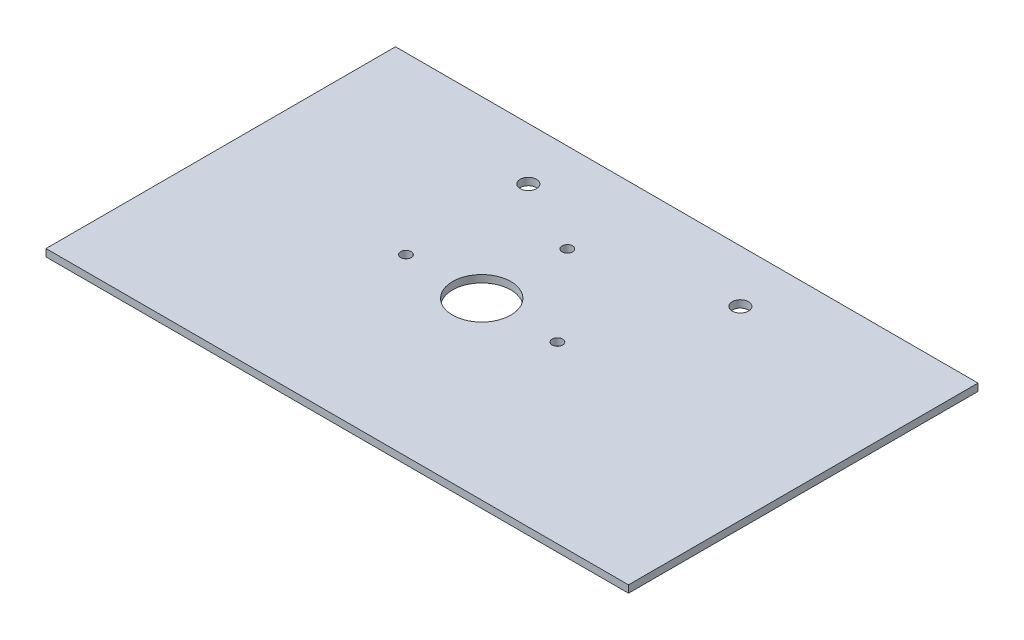
from build123d import *

# Parameters (mm, degrees)
SKETCH1_W          = 254
SKETCH1_H          = 3.175
BASE_FLANGE1_DEPTH = 76.2
SKETCH6_R          = 12.7
CUT_EXTRUDE1_DEPTH = 266.202791511
SKETCH7_R          = 2.286
CUT_EXTRUDE2_DEPTH = 266.202791511
SKETCH8_R          = 2.286
CUT_EXTRUDE3_DEPTH = 266.202791511
SKETCH9_R          = 3.556
CUT_EXTRUDE4_DEPTH = 266.202791511


# Sheet-metal steps are written as plain solids
with BuildPart() as part:
    # Sketch1 → Base-Flange1 (new, symmetric)
    with BuildSketch(Plane.XY):
        with Locations((-127, 1.5875)):
            Rectangle(SKETCH1_W, SKETCH1_H)
    extrude(amount=BASE_FLANGE1_DEPTH, both=True)

    # Sketch6 → Cut-Extrude1 (cut, through all)
    with BuildSketch(Plane.XZ):
        with Locations(Location((-140.208, 0, 0), (0, 0, 270))):
            Circle(SKETCH6_R)
    extrude(amount=-CUT_EXTRUDE1_DEPTH, mode=Mode.SUBTRACT)

    # Sketch7 → Cut-Extrude2 (cut, through all)
    with BuildSketch(Plane.XZ):
        with Locations(Location((-107.188, 0, 0), (0, 0, 270))):
            Circle(SKETCH7_R)
        with Locations(Location((-173.228, 0, 0), (0, 0, 90))):
            Circle(SKETCH7_R)
    extrude(amount=-CUT_EXTRUDE2_DEPTH, mode=Mode.SUBTRACT)

    # Sketch8 → Cut-Extrude3 (cut, through all)
    with BuildSketch(Plane.XZ):
        with Locations(Location((-140.208, -37.338, 0), (0, 0, 90))):
            Circle(SKETCH8_R)
    extrude(amount=-CUT_EXTRUDE3_DEPTH, mode=Mode.SUBTRACT)

    # Sketch9 → Cut-Extrude4 (cut, through all)
    with BuildSketch(Plane(origin=(0, 3.175, 0), x_dir=(1, 0, 0), z_dir=(0, 1, 0))):
        with Locations(Location((-173.228, 53.34, 0), (0, 0, 270))):
            Circle(SKETCH9_R)
        with Locations(Location((-80.772, 53.34, 0), (0, 0, 90))):
            Circle(SKETCH9_R)
    extrude(amount=-CUT_EXTRUDE4_DEPTH, mode=Mode.SUBTRACT)


solid = part.part
